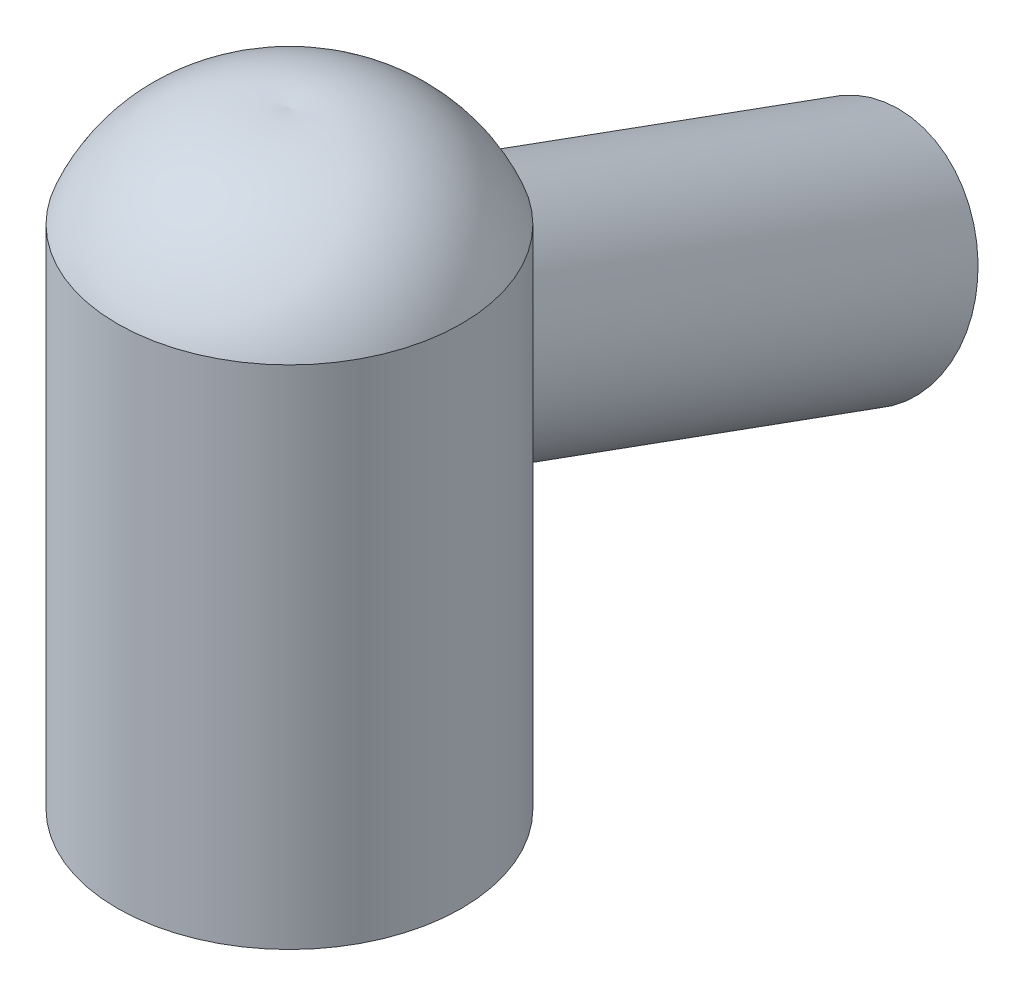
from build123d import *

# Parameters (mm, degrees)
SKETCH1_R                = 8.5
BOSS_EXTRUDE1_DEPTH      = 25
BOSS_EXTRUDE2_REACH      = 44.799
BOSS_EXTRUDE2_END_RADIUS = 8.5
SKETCH4_R                = 5.5
SHELL1_START             = -23.159597133
SHELL1_2_OUTLINE_R       = 2
SHELL1_2_DEPTH           = 26.159597133


with BuildPart() as part:
    # Sketch1 → Boss-Extrude1 (new body)
    with BuildSketch(Plane(origin=(0, 0, 0), x_dir=(1, 0, 0), z_dir=(0, 1, 0))):
        with Locations(Location((0, 0, 0), (0, 0, 270))):
            Circle(SKETCH1_R)
    extrude(amount=BOSS_EXTRUDE1_DEPTH)

    # Sketch2 → Revolve1 (revolve)
    with BuildSketch(Plane(origin=(0, 0, 0), x_dir=(0, 0, -1), z_dir=(1, 0, 0))):
        with BuildLine():
            Line((0, 25), (0, 30))
            ThreePointArc((0, 30), (5.112034816, 28.965459187), (8.5, 25))
            Line((8.5, 25), (0, 25))
        make_face()
    revolve(axis=Axis((0, 25, 0), (0, 1, 0)))

    # Boss-Extrude2: up to this cylinder (the profile starts outside it)
    boss_extrude2_end = Plane(origin=(0, 9.739396, 0), z_dir=(0, -1, 0)) * Cylinder(BOSS_EXTRUDE2_END_RADIUS, 107.598, mode=Mode.PRIVATE)
    # Sketch4 → Boss-Extrude2 (add, up to the surface)
    with BuildSketch(Plane(origin=(0, 9.7393957, -28.190778624), x_dir=(-1, 0, 0), z_dir=(0, -0.3420201433256657, -0.9396926207859096)), mode=Mode.PRIVATE) as boss_extrude2_sk1:
        with Locations(Location((0, 0, 0), (0, 0, 90))):
            Circle(SKETCH4_R)
    boss_extrude2_tool1 = extrude(boss_extrude2_sk1.sketch, amount=-BOSS_EXTRUDE2_REACH, mode=Mode.PRIVATE) - boss_extrude2_end
    add(boss_extrude2_tool1.solids().sort_by_distance((0, 9.739396, -28.190779))[0])

    # Shell1: read off the stored shape, not the designer's step
    # Shell1 outline → Shell1 (revolve, cut)
    with BuildSketch(Plane.XY):
        with BuildLine():
            Line((0, 26.444357479), (0, 0))
            Line((0, 0), (5, 0))
            Line((5, 0), (5, 24.236519229))
            add(Edge.make_bspline(
                [(5, 24.236519229), (4.572818275, 25.014193993), (3.910724446, 25.762107964), (3.017623345, 26.318986428), (2.002643397, 26.569985468), (0.836195706, 26.569985465), (0.619342604, 26.556580246), (0.406891162, 26.530460172), (0.200126847, 26.492663543), (0, 26.444357479)],
                knots=[4.721376583, 4.721376583, 4.721376583, 4.721376583, 4.721376583, 4.721376583, 5.780874766, 5.780874766, 5.780874766, 5.780874766, 6.026709165, 6.026709165, 6.026709165, 6.026709165, 6.026709165, 6.026709165], degree=5, weights=[1, 1, 0.993014221, 0.992005425, 1, 1, 0.999993273, 0.999995808, 1, 1]))
        make_face()
    revolve(axis=Axis((0, 0, 0), (0, 1, 0)), mode=Mode.SUBTRACT)

    # Shell1 2 outline → Shell1 2 (cut)
    with BuildSketch(Plane(origin=(0, 0, 0), x_dir=(1, 0, 0), z_dir=(0, 0.34202014332566616, 0.9396926207859094)).offset(SHELL1_START)):
        with Locations((0, 18.793852416)):
            Circle(SHELL1_2_OUTLINE_R)
    extrude(amount=SHELL1_2_DEPTH, mode=Mode.SUBTRACT)


solid = part.part
